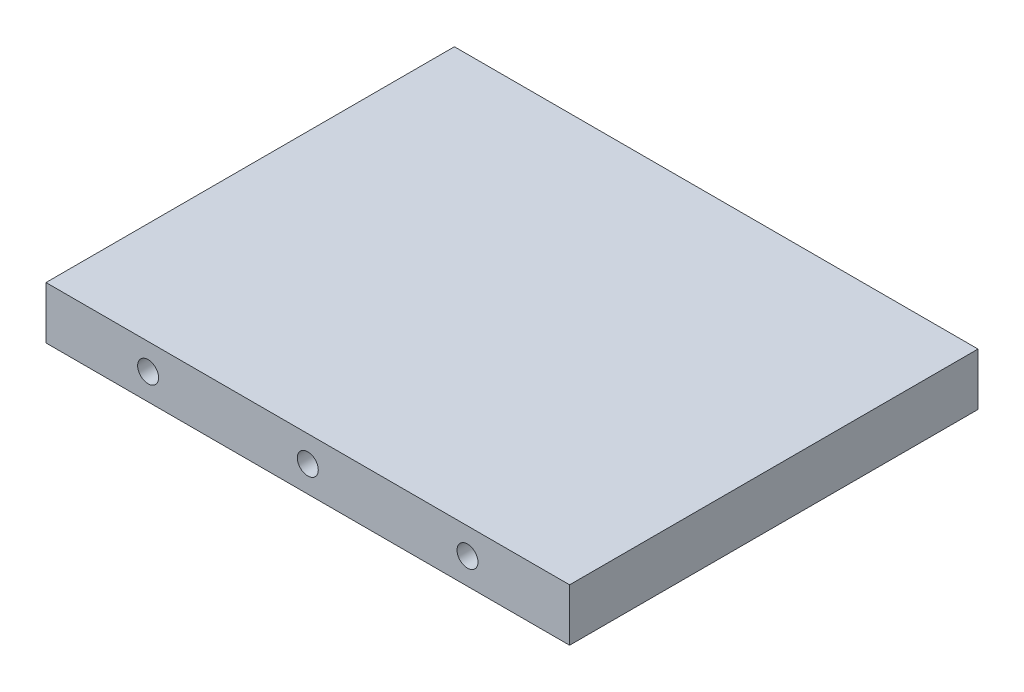
from build123d import *

# Parameters (mm, degrees)
SCHIZZO2_W                   = 100
SCHIZZO2_H                   = 10
ESTRUSIONE_ESTRUSIONE1_DEPTH = 78
SCHIZZO3_R                   = 2
TAGLIO_ESTRUSIONE1_DEPTH     = 15
TAGLIO_ESTRUSIONE2_START     = -15
SCHIZZO4_R                   = 2
TAGLIO_ESTRUSIONE2_DEPTH     = 15


with BuildPart() as part:
    # Schizzo2 → Estrusione-Estrusione1 (new body)
    with BuildSketch(Plane.XY):
        with Locations((50, 5)):
            Rectangle(SCHIZZO2_W, SCHIZZO2_H)
    extrude(amount=-ESTRUSIONE_ESTRUSIONE1_DEPTH)

    # Schizzo3 → Taglio-Estrusione1 (cut)
    with BuildSketch(Plane.XY):
        with Locations((19.5, 5)):
            Circle(SCHIZZO3_R)
        with Locations((50, 5)):
            Circle(SCHIZZO3_R)
        with Locations((80.5, 5)):
            Circle(SCHIZZO3_R)
    extrude(amount=-TAGLIO_ESTRUSIONE1_DEPTH, mode=Mode.SUBTRACT)

    # Schizzo4 → Taglio-Estrusione2 (cut)
    with BuildSketch(Plane(origin=(0, 0, -78), x_dir=(-1, 0, 0), z_dir=(0, 0, -1)).offset(TAGLIO_ESTRUSIONE2_START)):
        with Locations((-80.5, 5)):
            Circle(SCHIZZO4_R)
        with Locations((-50, 5)):
            Circle(SCHIZZO4_R)
        with Locations((-19.5, 5)):
            Circle(SCHIZZO4_R)
    extrude(amount=TAGLIO_ESTRUSIONE2_DEPTH, mode=Mode.SUBTRACT)


solid = part.part
